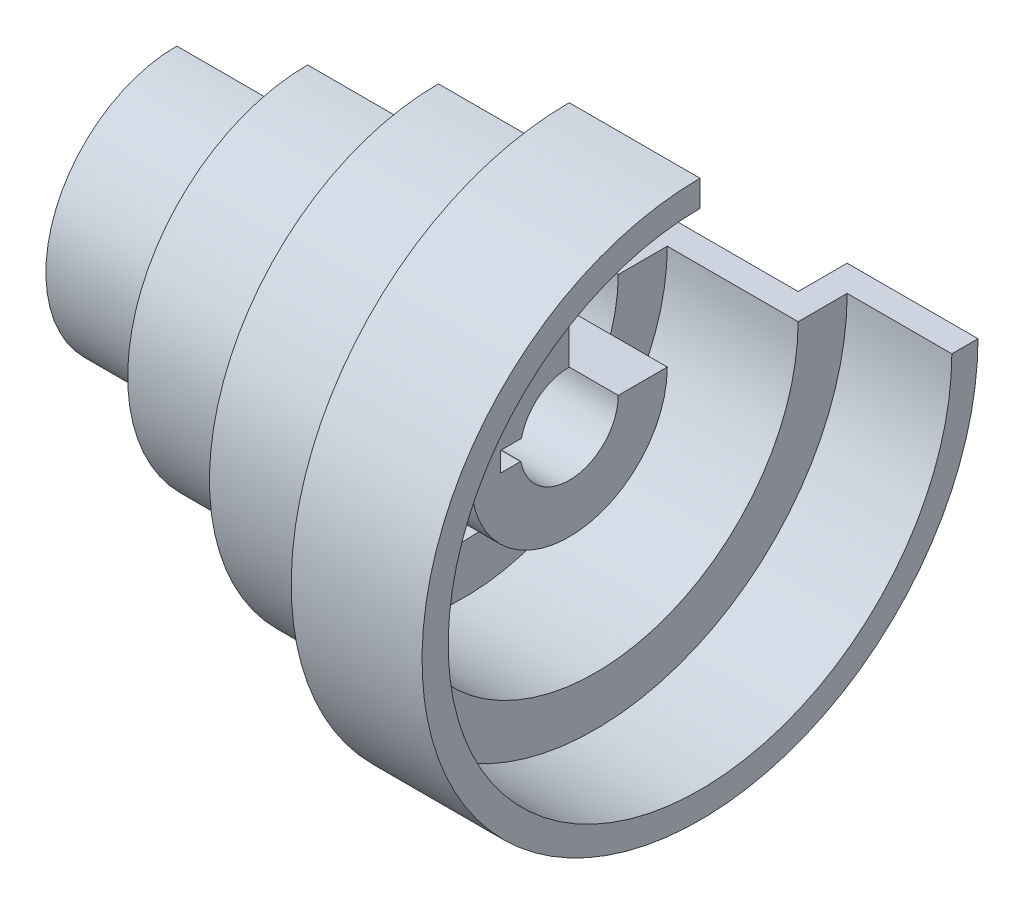
from build123d import *

# Parameters (mm, degrees)
REVOLVE1_ANGLE     = 270
CUT_EXTRUDE3_START = -120
CUT_EXTRUDE3_DEPTH = 120


# Read off the part's stored shape, not the designer's step: Cut-Extrude3
with BuildPart() as part:
    # Sketch1 → Revolve1 (revolve)
    with BuildSketch(Plane.XY):
        Polygon((-141.986286211, 15), (-21.986286211, 15), (-21.986286211, 30), (-93.986286211, 30), (-93.986286211, 47), (-53.986286211, 47), (-53.986286211, 62), (-13.986286211, 62), (-13.986286211, 77), (18.013713789, 77), (18.013713789, 85), (-21.986286211, 85), (-21.986286211, 70), (-61.986286211, 70), (-61.986286211, 55), (-101.986286211, 55), (-101.986286211, 40), (-141.986286211, 40), align=None)
    revolve(axis=Axis((-141.986286211, 0, 0), (1, 0, 0)), revolution_arc=REVOLVE1_ANGLE)

    # Cut-Extrude3 outline → Cut-Extrude3 (cut)
    with BuildSketch(Plane.ZY.offset(141.986286211).offset(CUT_EXTRUDE3_START)):
        with BuildLine():
            Line((14.774482913, -2.591265069), (21, -2.591265069))
            Line((21, -2.591265069), (21, 3.408734931))
            Line((21, 3.408734931), (14.607550314, 3.408734931))
            ThreePointArc((14.607550314, 3.408734931), (14.994197849, 0.41717007), (14.774482913, -2.591265069))
        make_face()
    extrude(amount=CUT_EXTRUDE3_DEPTH, mode=Mode.SUBTRACT)


solid = part.part
